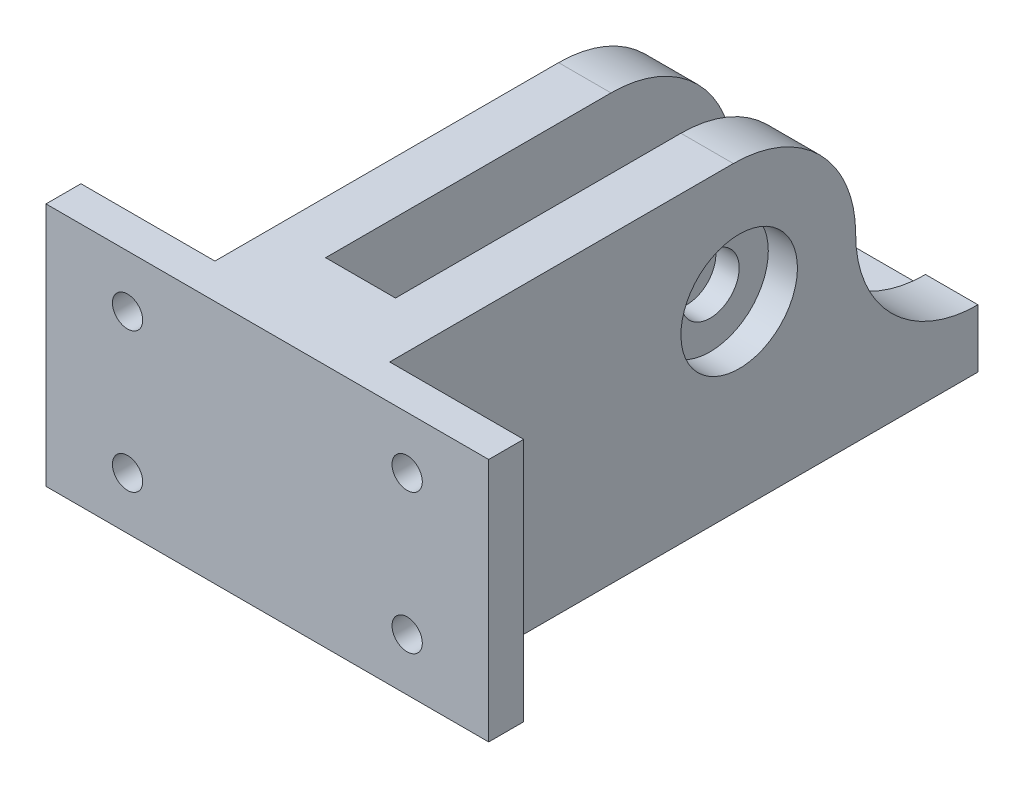
from build123d import *

# Parameters (mm, degrees)
SKETCH_1_W             = 38
SKETCH_1_H             = 21
EXTRUDE_1_DEPTH        = 3
SKETCH_2_R             = 1.3
CUT_EXTRUDE_1_DEPTH    = 3
PATTERN_LINEAR_1_COUNT = 2
PATTERN_LINEAR_1_PITCH = 24
SKETCH_9_W             = 15
SKETCH_9_H             = 21
EXTRUDE_5_DEPTH        = 40
SKETCH_10_R            = 5
CUT_EXTRUDE_5_DEPTH    = 60
SKETCH_11_W            = 6
SKETCH_11_H            = 21
CUT_EXTRUDE_6_DEPTH    = 35
SKETCH_12_R            = 6
EXTRUDE_6_DEPTH        = 2
SKETCH_14_R            = 6
EXTRUDE_8_DEPTH        = 2
SKETCH_15_R            = 2.5
CUT_EXTRUDE_7_DEPTH    = 20
SKETCH_16_W            = 15
SKETCH_16_H            = 50.5
EXTRUDE_9_DEPTH        = 5
FILLET_START           = -41.833744856
FILLET_2_DEPTH         = 38
FILLET_START_2         = -30.333744856
FILLET_2_2_DEPTH       = 4.5
FILLET_START_3         = -19.833744856
FILLET_2_3_DEPTH       = 4.5
FILLET_3_R             = 5
SKETCH_17_W            = 6
SKETCH_17_H            = 22
CUT_EXTRUDE_8_DEPTH    = 100


with BuildPart() as part:
    # 草图1 → 凸台-拉伸1 (new body)
    with BuildSketch(Plane.XY):
        with Locations((-22.833744856, 0.637037037)):
            Rectangle(SKETCH_1_W, SKETCH_1_H)
    extrude(amount=EXTRUDE_1_DEPTH)

    # 草图2 → 切除-拉伸1 (cut)
    with BuildSketch(Plane(origin=(0, 0, 0), x_dir=(-1, 0, 0), z_dir=(0, 0, -1))):
        with Locations((10.833744856, 6.637037037)):
            Circle(SKETCH_2_R)
        with Locations((10.833744856, -5.362962963)):
            Circle(SKETCH_2_R)
    cut_extrude_1 = extrude(amount=-CUT_EXTRUDE_1_DEPTH, mode=Mode.SUBTRACT)

    # 阵列(线性)1: 切除-拉伸1 ×2
    with Locations(*[(-i * PATTERN_LINEAR_1_PITCH, 0, 0) for i in range(1, PATTERN_LINEAR_1_COUNT)]):
        add(cut_extrude_1, mode=Mode.SUBTRACT)

    # 草图9 → 凸台-拉伸5 (add)
    with BuildSketch(Plane(origin=(0, 0, 0), x_dir=(-1, 0, 0), z_dir=(0, 0, -1))):
        with Locations((22.833744856, 0.637037037)):
            Rectangle(SKETCH_9_W, SKETCH_9_H)
    extrude(amount=EXTRUDE_5_DEPTH)

    # 草图10 → 切除-拉伸5 (cut)
    with BuildSketch(Plane(origin=(-15.333744856, 0, 0), x_dir=(0, 0, -1), z_dir=(1, 0, 0))):
        with Locations(Location((30, 0.637037037, 0), (0, 0, 90))):
            Circle(SKETCH_10_R)
    extrude(amount=-CUT_EXTRUDE_5_DEPTH, mode=Mode.SUBTRACT)

    # 草图11 → 切除-拉伸6 (cut)
    with BuildSketch(Plane(origin=(0, 0, -40), x_dir=(-1, 0, 0), z_dir=(0, 0, -1))):
        with Locations((22.833744856, 0.637037037)):
            Rectangle(SKETCH_11_W, SKETCH_11_H)
    extrude(amount=-CUT_EXTRUDE_6_DEPTH, mode=Mode.SUBTRACT)

    # 草图12 → 凸台-拉伸6 (add)
    with BuildSketch(Plane.ZY.offset(19.833744856)):
        with Locations((-30, 0.637037037)):
            Circle(SKETCH_12_R)
    extrude(amount=-EXTRUDE_6_DEPTH)

    # 草图14 → 凸台-拉伸8 (add)
    with BuildSketch(Plane(origin=(-25.833744856, 0, 0), x_dir=(0, 0, -1), z_dir=(1, 0, 0))):
        with Locations((30, 0.637037037)):
            Circle(SKETCH_14_R)
    extrude(amount=-EXTRUDE_8_DEPTH)

    # 草图15 → 切除-拉伸7 (cut)
    with BuildSketch(Plane(origin=(-17.833744856, 0, 0), x_dir=(0, 0, -1), z_dir=(1, 0, 0))):
        with Locations(Location((30, 0.637037037, 0), (0, 0, 90))):
            Circle(SKETCH_15_R)
    extrude(amount=-CUT_EXTRUDE_7_DEPTH, mode=Mode.SUBTRACT)

    # 草图16 → 凸台-拉伸9 (add)
    with BuildSketch(Plane(origin=(0, -9.862962963, 0), x_dir=(-1, 0, 0), z_dir=(0, -1, 0))):
        with Locations((22.833744856, 25.25)):
            Rectangle(SKETCH_16_W, SKETCH_16_H)
    extrude(amount=EXTRUDE_9_DEPTH)

    # 圆角2: read off the stored shape, not the designer's step
    # 圆角2 outline → 圆角2 (cut)
    with BuildSketch(Plane.YZ.offset(FILLET_START)):
        with BuildLine():
            Line((11.137037037, -40), (11.137037037, -29.5))
            ThreePointArc((11.137037037, -29.5), (8.061658239, -36.924621202), (0.637037037, -40))
            Line((0.637037037, -40), (11.137037037, -40))
        make_face()
    extrude(amount=FILLET_2_DEPTH, mode=Mode.SUBTRACT)

    # Fillet 2 2 outline → Fillet 2 2 (add)
    with BuildSketch(Plane.YZ.offset(FILLET_START_2)):
        with BuildLine():
            ThreePointArc((-9.862962963, -50.5), (-6.787584165, -43.075378798), (0.637037037, -40))
            Line((0.637037037, -40), (-9.862962963, -40))
            Line((-9.862962963, -40), (-9.862962963, -50.5))
        make_face()
    extrude(amount=FILLET_2_2_DEPTH)

    # Fillet 2 3 outline → Fillet 2 3 (add)
    with BuildSketch(Plane.YZ.offset(FILLET_START_3)):
        with BuildLine():
            ThreePointArc((-9.862962963, -50.5), (-6.787584165, -43.075378798), (0.637037037, -40))
            Line((0.637037037, -40), (-9.862962963, -40))
            Line((-9.862962963, -40), (-9.862962963, -50.5))
        make_face()
    extrude(amount=FILLET_2_3_DEPTH)

    # 圆角3
    fillet_3_edges = [part.edges().sort_by_distance(p)[0] for p in [
        (-22.833744856, -14.862962963, 0),
    ]]
    fillet(fillet_3_edges, radius=FILLET_3_R - 0.0001)  # a hair under: the kernel refuses the full size

    # 草图17 → 切除-拉伸8 (cut)
    with BuildSketch(Plane(origin=(0, 0, -5), x_dir=(-1, 0, 0), z_dir=(0, 0, -1))):
        with Locations((22.833744856, 0.137037037)):
            Rectangle(SKETCH_17_W, SKETCH_17_H)
    extrude(amount=CUT_EXTRUDE_8_DEPTH, mode=Mode.SUBTRACT)


solid = part.part
